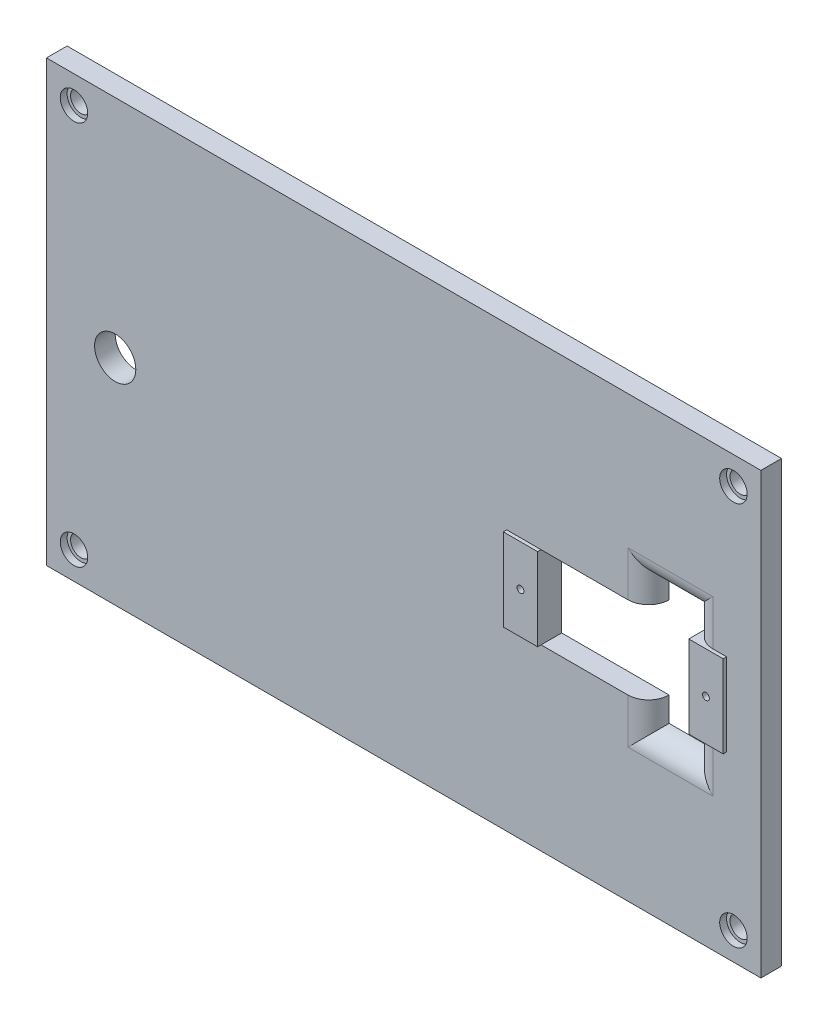
from build123d import *

# Parameters (mm, degrees)
SKETCH_1_W           = 104
SKETCH_1_H           = 64
EXTRUDE_1_DEPTH      = 3
SKETCH_2_R           = 1.5
CUT_EXTRUDE_1_DEPTH  = 62.131006862
SKETCH_4_R           = 2
CUT_EXTRUDE_3_DEPTH  = 1
SKETCH_12_W          = 5
SKETCH_12_H          = 12
EXTRUDE_4_DEPTH      = 0.5
SKETCH_13_R          = 0.5
CUT_EXTRUDE_8_DEPTH  = 62.15758334
SKETCH_15_W          = 22
SKETCH_15_H          = 12
CUT_EXTRUDE_10_DEPTH = 62.131006862
SKETCH_17_W          = 6.358168499
SKETCH_17_H          = 19.16029301
CUT_EXTRUDE_11_DEPTH = 4
FILLET_2_R           = 3
SKETCH_18_R          = 3
CUT_EXTRUDE_12_DEPTH = 6


with BuildPart() as part:
    # 草图1 → 凸台-拉伸1 (new body)
    with BuildSketch(Plane.XY):
        Rectangle(SKETCH_1_W, SKETCH_1_H)
    extrude(amount=EXTRUDE_1_DEPTH)

    # 草图2 → 切除-拉伸1 (cut, through all)
    with BuildSketch(Plane.XY.offset(3)):
        with Locations((-48, 28)):
            Circle(SKETCH_2_R)
        with Locations(Location((48, 28, 0), (0, 0, 180))):
            Circle(SKETCH_2_R)
        with Locations((48, -28)):
            Circle(SKETCH_2_R)
        with Locations(Location((-48, -28, 0), (0, 0, 180))):
            Circle(SKETCH_2_R)
    extrude(amount=-CUT_EXTRUDE_1_DEPTH, mode=Mode.SUBTRACT)

    # 草图4 → 切除-拉伸3 (cut)
    with BuildSketch(Plane.XY.offset(3)):
        with Locations((48, 28)):
            Circle(SKETCH_4_R)
        with Locations(Location((-48, 28, 0), (0, 0, 180))):
            Circle(SKETCH_4_R)
        with Locations((-48, -28)):
            Circle(SKETCH_4_R)
        with Locations(Location((48, -28, 0), (0, 0, 180))):
            Circle(SKETCH_4_R)
    extrude(amount=-CUT_EXTRUDE_3_DEPTH, mode=Mode.SUBTRACT)

    # 草图12 → 凸台-拉伸4 (add)
    with BuildSketch(Plane.XY.offset(3)):
        with Locations((17.5, 0)):
            Rectangle(SKETCH_12_W, SKETCH_12_H)
        with Locations((44.5, 0)):
            Rectangle(SKETCH_12_W, SKETCH_12_H)
    extrude(amount=EXTRUDE_4_DEPTH)

    # 草图13 → 切除-拉伸8 (cut, through all)
    with BuildSketch(Plane.XY.offset(3.5)):
        with Locations((17.5, 0)):
            Circle(SKETCH_13_R)
        with Locations((44.5, 0)):
            Circle(SKETCH_13_R)
    extrude(amount=-CUT_EXTRUDE_8_DEPTH, mode=Mode.SUBTRACT)

    # 草图15 → 切除-拉伸10 (cut, through all)
    with BuildSketch(Plane.XY.offset(3)):
        with Locations((31, 0)):
            Rectangle(SKETCH_15_W, SKETCH_15_H)
    extrude(amount=-CUT_EXTRUDE_10_DEPTH, mode=Mode.SUBTRACT)

    # 草图17 → 切除-拉伸11 (cut)
    with BuildSketch(Plane.XY.offset(3)):
        with Locations((38.820915751, 0)):
            Rectangle(SKETCH_17_W, SKETCH_17_H)
    extrude(amount=-CUT_EXTRUDE_11_DEPTH, mode=Mode.SUBTRACT)

    # 圆角2
    fillet_2_edges = [part.edges().sort_by_distance(p)[0] for p in [
        (35.641831501, -7.790073253, 3),
        (38.82091575, -9.580146505, 3),
        (42, -7.790073253, 3),
        (42, 7.790073253, 3),
        (38.82091575, 9.580146505, 3),
        (35.641831501, 7.790073253, 3),
    ]]
    fillet(fillet_2_edges, radius=FILLET_2_R - 0.0001)  # a hair under: the kernel refuses the full size

    # 草图18 → 切除-拉伸12 (cut)
    with BuildSketch(Plane.XY.offset(3)):
        with Locations((-42, -0.800014708)):
            Circle(SKETCH_18_R)
    extrude(amount=-CUT_EXTRUDE_12_DEPTH, mode=Mode.SUBTRACT)


solid = part.part
